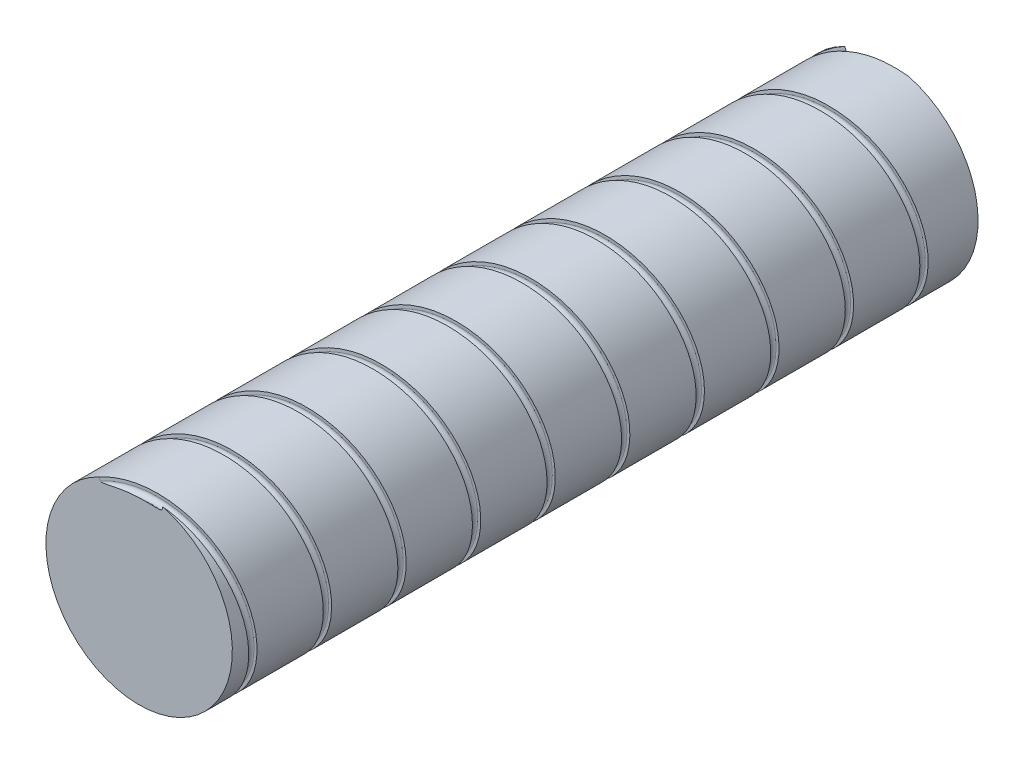
from build123d import *

# Parameters (mm, degrees)
SKETCH1_R           = 2
BOSS_EXTRUDE1_DEPTH = 16
CUT_SWEEP2_PITCH    = 1.6


with BuildPart() as part:
    # Sketch1 → Boss-Extrude1 (new body)
    with BuildSketch(Plane.XY):
        Circle(SKETCH1_R)
    extrude(amount=BOSS_EXTRUDE1_DEPTH)

    # Cut-Sweep2: arcs per turn and ends read off the stored shape
    # Cut-Sweep2: the profile of Sketch4 screwed along a right-hand helix through 11.5 turns, 8 arcs to a turn; built about Z, then put on its axis
    cut_sweep2_z = Axis((0, 0, 0), (0, 0, 1))
    cut_sweep2_corners = [(1.934902268, 0, -1.535473972), (2.068658469, 0, -1.535473972), (2.157816412, 0, -1.624631916), (2.068658469, 0, -1.713789859), (1.934902268, 0, -1.713789859), (1.845744324, 0, -1.624631916)]
    with BuildLine(mode=Mode.PRIVATE) as cut_sweep2_profile:
        Line(cut_sweep2_corners[0], cut_sweep2_corners[1])
        Line(cut_sweep2_corners[3], cut_sweep2_corners[4])
        ThreePointArc((2.068658469, 0, -1.535473972), (2.131702655, 0, -1.561587729), (2.157816412, 0, -1.624631916))
        ThreePointArc((2.157816412, 0, -1.624631916), (2.131702655, 0, -1.687676102), (2.068658469, 0, -1.713789859))
        ThreePointArc((1.934902268, 0, -1.713789859), (1.871858081, 0, -1.687676102), (1.845744324, 0, -1.624631916))
        ThreePointArc((1.845744324, 0, -1.624631916), (1.871858081, 0, -1.561587729), (1.934902268, 0, -1.535473972))
    cut_sweep2_cap = Face(cut_sweep2_profile.wire())
    cut_sweep2_arcs = [((2.068658469, 0, -1.535473972), (2.157816412, 0, -1.535473972), (2.157816412, 0, -1.624631916), (1, 0.7071067811865476, 1)), ((2.157816412, 0, -1.624631916), (2.157816412, 0, -1.713789859), (2.068658469, 0, -1.713789859), (1, 0.7071067811865476, 1)), ((1.934902268, 0, -1.713789859), (1.845744324, 0, -1.713789859), (1.845744324, 0, -1.624631916), (1, 0.7071067811865476, 1)), ((1.845744324, 0, -1.624631916), (1.845744324, 0, -1.535473972), (1.934902268, 0, -1.535473972), (1, 0.7071067811865476, 1))]  # start, shoulder, end, weights
    cut_sweep2_turn_angles = [0, 22.5, 45, 67.5, 90, 112.5, 135, 157.5, 180, 202.5, 225, 247.5, 270, 292.5, 315, 337.5, 360]
    cut_sweep2_turn_weights = [1, 0.9238795325112867, 1, 0.9238795325112867, 1, 0.9238795325112867, 1, 0.9238795325112867, 1, 0.9238795325112867, 1, 0.9238795325112867, 1, 0.9238795325112867, 1, 0.9238795325112867, 1]
    cut_sweep2_turn_rails = [Edge.make_bspline([Vector(p[0], p[1], 0).rotate(cut_sweep2_z, cut_sweep2_turn_angles[k]) / cut_sweep2_turn_weights[k] + Vector(0, 0, p[2] + CUT_SWEEP2_PITCH * cut_sweep2_turn_angles[k] / 360) for k in range(17)], [0, 0, 0, 1, 1, 2, 2, 3, 3, 4, 4, 5, 5, 6, 6, 7, 7, 8, 8, 8], 2, cut_sweep2_turn_weights) for p in cut_sweep2_corners]
    cut_sweep2_turn_sides = [*[Face.make_surface_from_curves(cut_sweep2_turn_rails[p[0]], cut_sweep2_turn_rails[p[1]]) for p in [(0, 1), (3, 4)]], *[Face.make_bezier_surface([[Vector(p[j][0], p[j][1], 0).rotate(cut_sweep2_z, cut_sweep2_turn_angles[2 * i + k]) / cut_sweep2_turn_weights[2 * i + k] + Vector(0, 0, p[j][2] + CUT_SWEEP2_PITCH * cut_sweep2_turn_angles[2 * i + k] / 360) for k in range(3)] for j in range(3)], [[p[3][j] * cut_sweep2_turn_weights[2 * i + k] for k in range(3)] for j in range(3)]) for p in cut_sweep2_arcs for i in range(8)]]
    cut_sweep2_last_angles = [3960, 3982.5, 4005, 4027.5, 4050, 4072.5, 4095, 4117.5, 4140]
    cut_sweep2_last_weights = [1, 0.9238795325112867, 1, 0.9238795325112867, 1, 0.9238795325112867, 1, 0.9238795325112867, 1]
    cut_sweep2_last_rails = [Edge.make_bspline([Vector(p[0], p[1], 0).rotate(cut_sweep2_z, cut_sweep2_last_angles[k]) / cut_sweep2_last_weights[k] + Vector(0, 0, p[2] + CUT_SWEEP2_PITCH * cut_sweep2_last_angles[k] / 360) for k in range(9)], [0, 0, 0, 1, 1, 2, 2, 3, 3, 4, 4, 4], 2, cut_sweep2_last_weights) for p in cut_sweep2_corners]
    cut_sweep2_last_sides = [*[Face.make_surface_from_curves(cut_sweep2_last_rails[p[0]], cut_sweep2_last_rails[p[1]]) for p in [(0, 1), (3, 4)]], *[Face.make_bezier_surface([[Vector(p[j][0], p[j][1], 0).rotate(cut_sweep2_z, cut_sweep2_last_angles[2 * i + k]) / cut_sweep2_last_weights[2 * i + k] + Vector(0, 0, p[j][2] + CUT_SWEEP2_PITCH * cut_sweep2_last_angles[2 * i + k] / 360) for k in range(3)] for j in range(3)], [[p[3][j] * cut_sweep2_last_weights[2 * i + k] for k in range(3)] for j in range(3)]) for p in cut_sweep2_arcs for i in range(4)]]
    cut_sweep2 = Plane(origin=(0, 0, 0), x_dir=(0, 1, 0), z_dir=(0, 0, 1)) * Solid(Shell([*[p.moved(Location((0, 0, CUT_SWEEP2_PITCH * i))) for i in range(11) for p in cut_sweep2_turn_sides], *cut_sweep2_last_sides, cut_sweep2_cap, cut_sweep2_cap.rotate(cut_sweep2_z, 4140).moved(Location((0, 0, CUT_SWEEP2_PITCH * 4140 / 360)))]))
    add(cut_sweep2, mode=Mode.SUBTRACT)


solid = part.part
